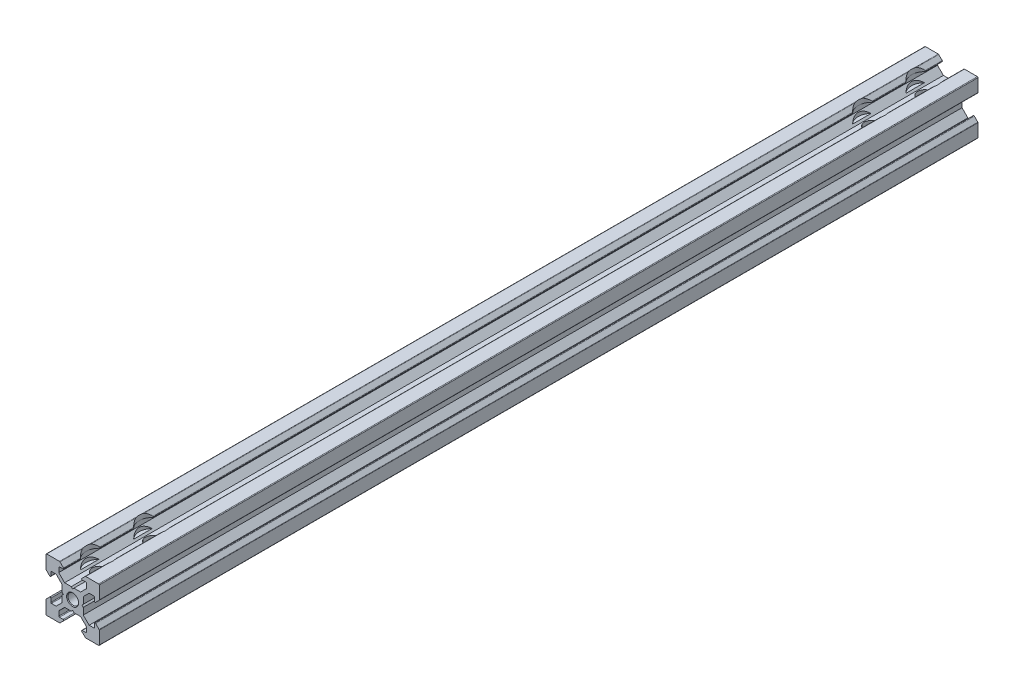
from build123d import *

# Parameters (mm, degrees)
SALIENTE_EXTRUIR1_DEPTH                              = 165
SALIENTE_EXTRUIR1_DEPTH_BACK                         = 165
REFRENTADO_PARA_TORNILLO_CON_CABEZA_HUEC_D           = 5.3
REFRENTADO_PARA_TORNILLO_CON_CABEZA_HUEC_DEPTH       = 30
REFRENTADO_PARA_TORNILLO_CON_CABEZA_HUEC_CBORE_D     = 10
REFRENTADO_PARA_TORNILLO_CON_CABEZA_HUEC_CBORE_DEPTH = 5.4
REFRENTADO_PARA_TORNILLO_CON_CABEZA_HUEC_TIP         = 1.59228064
CROQUIS7_R                                           = 2
CORTAR_EXTRUIR1_DEPTH                                = 331.303220717
CHAFL_N1_SIZE                                        = 0.25


with BuildPart() as part:
    # Croquis1 → Saliente-Extruir1 (new, two sides: drawn at the far end of the back side and taken through both)
    with BuildSketch(Plane.XY.offset(-SALIENTE_EXTRUIR1_DEPTH_BACK)):
        with BuildLine():
            Line((-3.987829457, 0.499361283), (-3.487829457, -0.000638717))
            Line((-3.487829457, -0.000638717), (-3.987559517, -0.500368777))
            Line((-3.987559517, -0.500368777), (-3.987559517, -3.008827233))
            Line((-3.987559517, -3.008827233), (-6.187829457, -5.209097173))
            Line((-6.187829457, -5.209097173), (-7.930785329, -5.209097173))
            ThreePointArc((-7.930785329, -5.209097173), (-8.107562024, -5.135873868), (-8.180785329, -4.959097173))
            Line((-8.180785329, -4.959097173), (-8.180785329, -3.614398294))
            ThreePointArc((-8.180785329, -3.614398294), (-8.335114237, -3.383428508), (-8.607561665, -3.43762124))
            Line((-8.607561665, -3.43762124), (-9.913674799, -4.743729068))
            ThreePointArc((-9.913674799, -4.743729068), (-9.967868248, -4.824835029), (-9.986898462, -4.920506122))
            Line((-9.986898462, -4.920506122), (-9.986898462, -9.749046667))
            ThreePointArc((-9.986898462, -9.749046667), (-9.913675158, -9.925823362), (-9.736898462, -9.999046667))
            Line((-9.736898462, -9.999046667), (-4.889520858, -9.999046667))
            ThreePointArc((-4.889520858, -9.999046667), (-4.79385, -9.98001655), (-4.712744163, -9.925823362))
            Line((-4.712744163, -9.925823362), (-3.412744163, -8.625823362))
            ThreePointArc((-3.412744163, -8.625823362), (-3.358550975, -8.353375809), (-3.589520858, -8.199046667))
            Line((-3.589520858, -8.199046667), (-4.947879963, -8.199046667))
            ThreePointArc((-4.947879963, -8.199046667), (-5.124656659, -8.125823362), (-5.197879963, -7.949046667))
            Line((-5.197879963, -7.949046667), (-5.197879963, -6.302600057))
            ThreePointArc((-5.197879963, -6.302600057), (-5.178849847, -6.206929199), (-5.124656659, -6.125823362))
            Line((-5.124656659, -6.125823362), (-2.998810958, -3.999977662))
            Line((-2.998810958, -3.999977662), (-0.486898462, -3.999977662))
            Line((-0.486898462, -3.999977662), (0.013101538, -3.499977662))
            Line((0.013101538, -3.499977662), (0.512831598, -3.999707722))
            Line((0.512831598, -3.999707722), (3.021290054, -3.999707722))
            Line((3.021290054, -3.999707722), (5.221559994, -6.199977662))
            Line((5.221559994, -6.199977662), (5.221559994, -7.942933534))
            ThreePointArc((5.221559994, -7.942933534), (5.148336689, -8.119710229), (4.971559994, -8.192933534))
            Line((4.971559994, -8.192933534), (3.626861115, -8.192933534))
            ThreePointArc((3.626861115, -8.192933534), (3.395891329, -8.347262441), (3.450084061, -8.61970987))
            Line((3.450084061, -8.61970987), (4.756191889, -9.925823003))
            ThreePointArc((4.756191889, -9.925823003), (4.83729785, -9.980016453), (4.932968943, -9.999046667))
            Line((4.932968943, -9.999046667), (9.761509488, -9.999046667))
            ThreePointArc((9.761509488, -9.999046667), (9.938286183, -9.925823362), (10.011509488, -9.749046667))
            Line((10.011509488, -9.749046667), (10.011509488, -4.901669063))
            ThreePointArc((10.011509488, -4.901669063), (9.992479371, -4.805998205), (9.938286183, -4.724892367))
            Line((9.938286183, -4.724892367), (8.638286183, -3.424892367))
            ThreePointArc((8.638286183, -3.424892367), (8.36583863, -3.370699179), (8.211509488, -3.601669063))
            Line((8.211509488, -3.601669063), (8.211509488, -4.960028168))
            ThreePointArc((8.211509488, -4.960028168), (8.138286183, -5.136804863), (7.961509488, -5.210028168))
            Line((7.961509488, -5.210028168), (6.211509488, -5.210028168))
            Line((6.211509488, -5.210028168), (4.012440483, -3.010959163))
            Line((4.012440483, -3.010959163), (4.012440483, -0.499046667))
            Line((4.012440483, -0.499046667), (3.512440483, 0.000953333))
            Line((3.512440483, 0.000953333), (4.012170543, 0.500683393))
            Line((4.012170543, 0.500683393), (4.012170543, 3.00914185))
            Line((4.012170543, 3.00914185), (6.212440483, 5.20941179))
            Line((6.212440483, 5.20941179), (7.955396355, 5.20941179))
            ThreePointArc((7.955396355, 5.20941179), (8.13217305, 5.136188485), (8.205396355, 4.95941179))
            Line((8.205396355, 4.95941179), (8.205396355, 3.61471291))
            ThreePointArc((8.205396355, 3.61471291), (8.359725262, 3.383743124), (8.632172691, 3.437935856))
            Line((8.632172691, 3.437935856), (9.938285824, 4.744043684))
            ThreePointArc((9.938285824, 4.744043684), (9.992479274, 4.825149646), (10.011509488, 4.920820738))
            Line((10.011509488, 4.920820738), (10.011509488, 9.749361283))
            ThreePointArc((10.011509488, 9.749361283), (9.938286183, 9.926137979), (9.761509488, 9.999361283))
            Line((9.761509488, 9.999361283), (4.914131884, 9.999361283))
            ThreePointArc((4.914131884, 9.999361283), (4.818461026, 9.980331166), (4.737355188, 9.926137979))
            Line((4.737355188, 9.926137979), (3.437355188, 8.626137979))
            ThreePointArc((3.437355188, 8.626137979), (3.383162001, 8.353690425), (3.614131884, 8.199361283))
            Line((3.614131884, 8.199361283), (4.972490989, 8.199361283))
            ThreePointArc((4.972490989, 8.199361283), (5.149267684, 8.126137979), (5.222490989, 7.949361283))
            Line((5.222490989, 7.949361283), (5.222490989, 6.199361283))
            Line((5.222490989, 6.199361283), (3.023421984, 4.000292278))
            Line((3.023421984, 4.000292278), (0.511509488, 4.000292278))
            Line((0.511509488, 4.000292278), (0.011509488, 3.500292278))
            Line((0.011509488, 3.500292278), (-0.488220572, 4.000022338))
            Line((-0.488220572, 4.000022338), (-2.996679029, 4.000022338))
            Line((-2.996679029, 4.000022338), (-5.196948969, 6.200292278))
            Line((-5.196948969, 6.200292278), (-5.196948969, 7.94324815))
            ThreePointArc((-5.196948969, 7.94324815), (-5.123725664, 8.120024846), (-4.946948969, 8.19324815))
            Line((-4.946948969, 8.19324815), (-3.602250089, 8.19324815))
            ThreePointArc((-3.602250089, 8.19324815), (-3.371280303, 8.347577058), (-3.425473035, 8.620024487))
            Line((-3.425473035, 8.620024487), (-4.731580863, 9.92613762))
            ThreePointArc((-4.731580863, 9.92613762), (-4.812686825, 9.980331069), (-4.908357917, 9.999361283))
            Line((-4.908357917, 9.999361283), (-9.736898462, 9.999361283))
            ThreePointArc((-9.736898462, 9.999361283), (-9.913675158, 9.926137979), (-9.986898462, 9.749361283))
            Line((-9.986898462, 9.749361283), (-9.986898462, 4.901983679))
            ThreePointArc((-9.986898462, 4.901983679), (-9.967868345, 4.806312821), (-9.913675158, 4.725206984))
            Line((-9.913675158, 4.725206984), (-8.613675158, 3.425206984))
            ThreePointArc((-8.613675158, 3.425206984), (-8.341227604, 3.371013796), (-8.186898462, 3.601983679))
            Line((-8.186898462, 3.601983679), (-8.186898462, 4.960342784))
            ThreePointArc((-8.186898462, 4.960342784), (-8.113675158, 5.13711948), (-7.936898462, 5.210342784))
            Line((-7.936898462, 5.210342784), (-6.186898462, 5.210342784))
            Line((-6.186898462, 5.210342784), (-3.987829457, 3.011273779))
            Line((-3.987829457, 3.011273779), (-3.987829457, 0.499361283))
        make_face()
    extrude(amount=SALIENTE_EXTRUIR1_DEPTH + SALIENTE_EXTRUIR1_DEPTH_BACK)

    # Refrentado para tornillo con cabeza hueca de M51
    with Locations(Plane(origin=(0, 9.999361283, 0), x_dir=(1, 0, 0), z_dir=(0, 1, 0))):
        with Locations((0.011509488, 155), (0.011509488, 135), (0.011509488, -135), (0.011509488, -155)):
            CounterBoreHole(REFRENTADO_PARA_TORNILLO_CON_CABEZA_HUEC_D / 2, REFRENTADO_PARA_TORNILLO_CON_CABEZA_HUEC_CBORE_D / 2, REFRENTADO_PARA_TORNILLO_CON_CABEZA_HUEC_CBORE_DEPTH, depth=REFRENTADO_PARA_TORNILLO_CON_CABEZA_HUEC_DEPTH)
            with Locations((0, 0, -(REFRENTADO_PARA_TORNILLO_CON_CABEZA_HUEC_DEPTH + REFRENTADO_PARA_TORNILLO_CON_CABEZA_HUEC_TIP / 2))):  # 118° drill point
                Cone(0, REFRENTADO_PARA_TORNILLO_CON_CABEZA_HUEC_D / 2, REFRENTADO_PARA_TORNILLO_CON_CABEZA_HUEC_TIP, mode=Mode.SUBTRACT)

    # Croquis7 → Cortar-Extruir1 (cut, through all)
    with BuildSketch(Plane.XY.offset(165)):
        Circle(CROQUIS7_R)
    extrude(amount=-CORTAR_EXTRUIR1_DEPTH, mode=Mode.SUBTRACT)

    # Chaflán1
    chafl_n1_edges = [part.edges().sort_by_distance(p)[0] for p in [
        (-2, 0, -165),
        (-2, 0, 165),
    ]]
    chamfer(chafl_n1_edges, length=CHAFL_N1_SIZE)


solid = part.part
